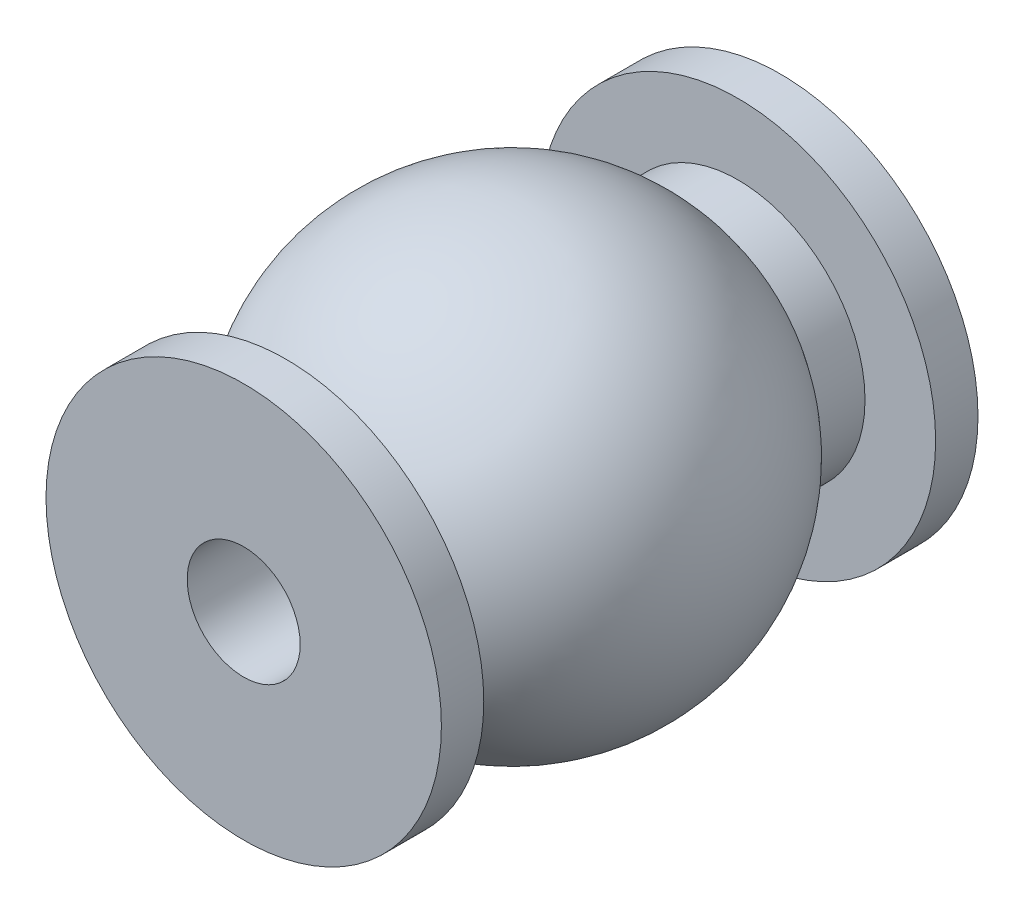
from build123d import *

# Parameters (mm, degrees)
F_4_0_4_DIAMETER_HOLE1_D = 4


with BuildPart() as part:
    # Sketch1 → Revolve1 (revolve)
    with BuildSketch(Plane(origin=(0, 0, 0), x_dir=(1, 0, 0), z_dir=(0, 1, 0))):
        with BuildLine():
            Line((-4.5, -6.309714732), (-4.5, -8))
            Line((-4.5, -8), (-7, -8))
            Line((-7, -8), (-7, -9.5))
            Line((-7, -9.5), (0, -9.5))
            Line((0, -9.5), (0, 9.5))
            Line((0, 9.5), (-7, 9.5))
            Line((-7, 9.5), (-7, 8))
            Line((-7, 8), (-4.5, 8))
            Line((-4.5, 8), (-4.5, 6.309714732))
            ThreePointArc((-4.5, 6.309714732), (-7.75, 0), (-4.5, -6.309714732))
        make_face()
    revolve(axis=Axis((0, 0, 9.5), (0, 0, -1)))

    # Ø4.0 (4) Diameter Hole1 (through all)
    with Locations(Plane.XY.offset(9.5)):
        with Locations((0, 0)):
            Hole(F_4_0_4_DIAMETER_HOLE1_D / 2)


solid = part.part
